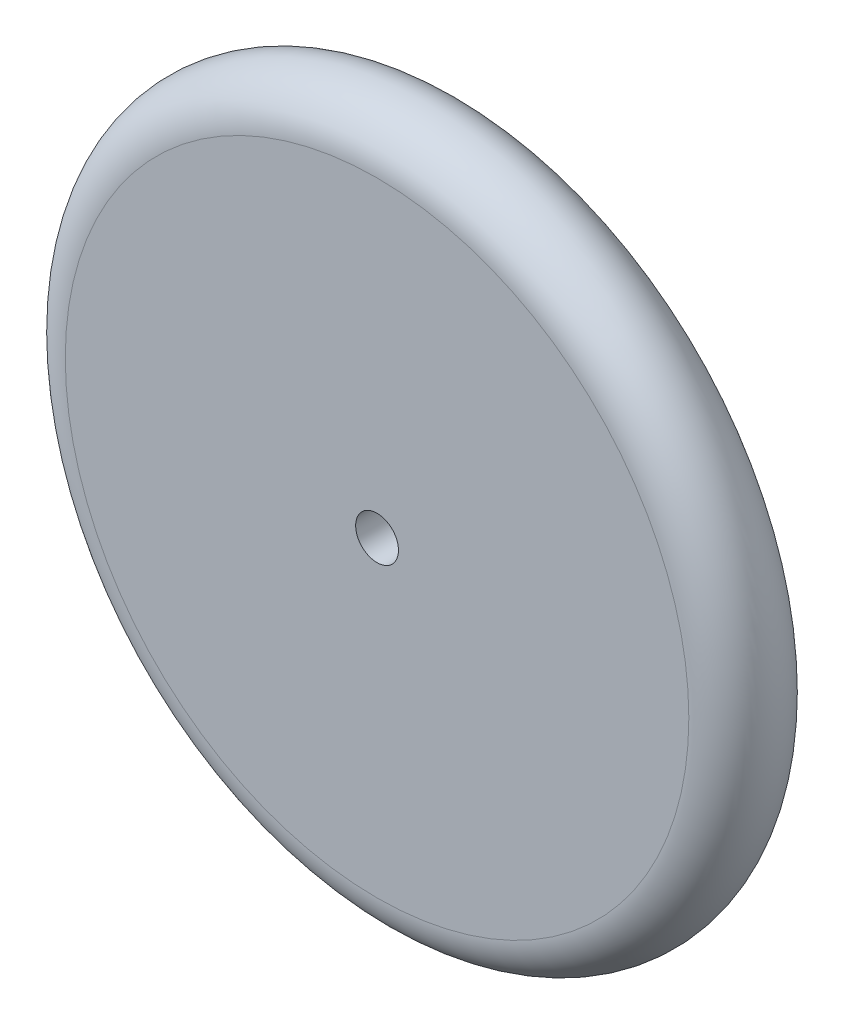
from build123d import *

# Parameters (mm, degrees)
SKETCH1_R           = 158.75
SKETCH1_R_2         = 9.525
BOSS_EXTRUDE1_DEPTH = 40
FILLET1_R           = 20


with BuildPart() as part:
    # Sketch1 → Boss-Extrude1 (new body)
    with BuildSketch(Plane.XY):
        Circle(SKETCH1_R)
        Circle(SKETCH1_R_2, mode=Mode.SUBTRACT)
    extrude(amount=BOSS_EXTRUDE1_DEPTH)

    # Fillet1
    fillet1_edges = [part.edges().sort_by_distance(p)[0] for p in [
        (-158.75, 0, 0),
        (-158.75, 0, 40),
    ]]
    fillet(fillet1_edges, radius=FILLET1_R - 0.0001)  # a hair under: the kernel refuses the full size


solid = part.part
